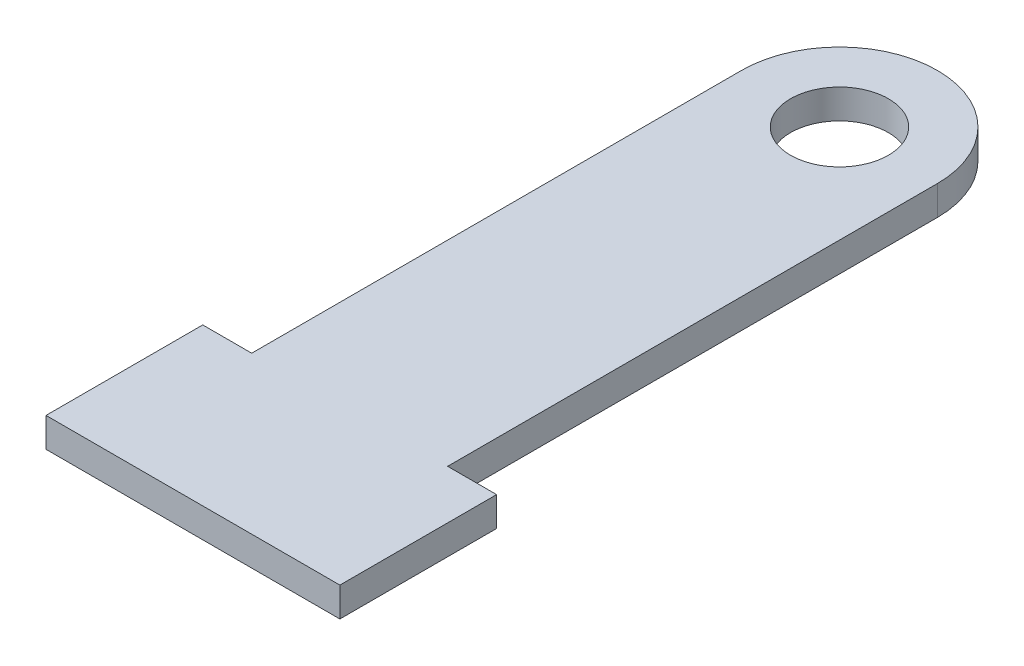
from build123d import *

# Parameters (mm, degrees)
SKETCH1_R          = 0.5
BASE_FLANGE1_DEPTH = 0.3


# Sheet-metal steps are written as plain solids
with BuildPart() as part:
    # Sketch1 → Base-Flange1 (new body)
    with BuildSketch(Plane(origin=(0, 0, 0), x_dir=(1, 0, 0), z_dir=(0, 1, 0))):
        with BuildLine():
            Line((-1, 0), (-1, 5))
            ThreePointArc((-1, 5), (0, 6), (1, 5))
            Line((1, 5), (1, 0))
            Line((1, 0), (1.5, 0))
            Line((1.5, 0), (1.5, -1.6))
            Line((1.5, -1.6), (-1.5, -1.6))
            Line((-1.5, -1.6), (-1.5, 0))
            Line((-1.5, 0), (-1, 0))
        make_face()
        with Locations(Location((0, 5, 0), (0, 0, 270))):
            Circle(SKETCH1_R, mode=Mode.SUBTRACT)
    extrude(amount=-BASE_FLANGE1_DEPTH)


solid = part.part
